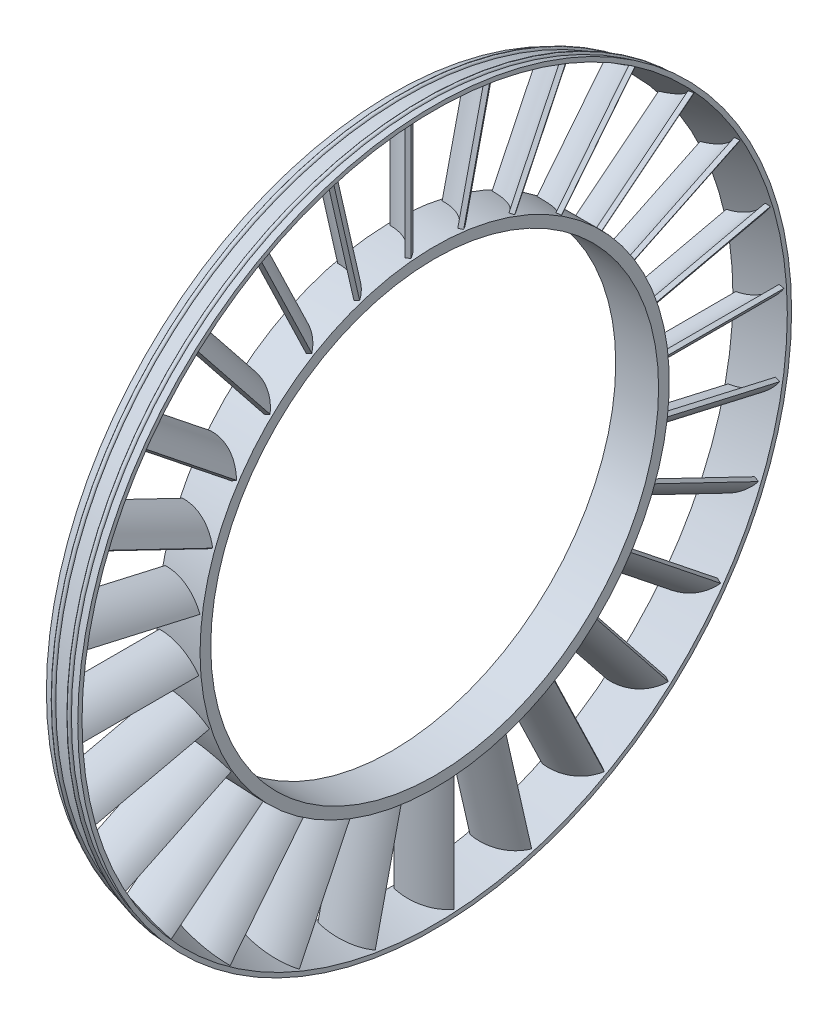
from build123d import *

# Parameters (mm, degrees)
SKETCH1_W           = 20
SKETCH1_H           = 5
EXTRUDE_THIN1_REACH = 237.778
CIRPATTERN1_COUNT   = 28
SKETCH4_R           = 104.5
CUT_EXTRUDE1_DEPTH  = 20


with BuildPart() as part:
    # Sketch1 → Revolve1 (revolve)
    with BuildSketch(Plane.XY):
        with Locations((0, 107)):
            Rectangle(SKETCH1_W, SKETCH1_H)
        with BuildLine():
            Line((-10, 159.2), (10, 164.57))
            Line((10, 164.57), (10, 166.57))
            Line((10, 166.57), (5.965792707, 165.486815342))
            ThreePointArc((5.965792707, 165.486815342), (4.740684658, 166.193292707), (4.034207293, 164.968184658))
            Line((4.034207293, 164.968184658), (-4.034207293, 162.801815342))
            ThreePointArc((-4.034207293, 162.801815342), (-5.259315342, 163.508292707), (-5.965792707, 162.283184658))
            Line((-5.965792707, 162.283184658), (-10, 161.2))
            Line((-10, 161.2), (-10, 159.2))
        make_face()
    revolve(axis=Axis((-19.030612245, 0, 0), (1, 0, 0)))

    # Extrude-Thin1: up to this cone (the profile starts inside it)
    extrude_thin1_end = Plane(origin=(0.462421, 0, 0), z_dir=(1, 0, 0)) * Cone(54.532057568, 269.486262509, 800.574320077, mode=Mode.PRIVATE)
    # Sketch3 → Extrude-Thin1 (add, up to the surface)
    with BuildSketch(Plane(origin=(0, 0, 0), x_dir=(1, 0, 0), z_dir=(0, 1, 0)), mode=Mode.PRIVATE) as extrude_thin1_sk1:
        with BuildLine():
            ThreePointArc((-9, 0), (1.381923414, -2.512537855), (9, -10))
            Line((9, -10), (7.268742617, -11.001372995))
            ThreePointArc((7.268742617, -11.001372995), (0.410637552, -4.260852407), (-8.935595812, -1.998962756))
            Line((-8.935595812, -1.998962756), (-9, 0))
        make_face()
    extrude_thin1_tool1 = extrude(extrude_thin1_sk1.sketch, amount=EXTRUDE_THIN1_REACH, mode=Mode.PRIVATE) & extrude_thin1_end
    extrude_thin1 = extrude_thin1_tool1.solids().sort_by_distance((0.462421, 0, 4.167643))[0]
    add(extrude_thin1)

    # CirPattern1: Extrude-Thin1 ×28 about axis
    cirpattern1_axis = Axis((-19.030612245, 0, 0), (-1, 0, 0))
    for i in range(1, CIRPATTERN1_COUNT):
        add(extrude_thin1.rotate(cirpattern1_axis, i * 360 / CIRPATTERN1_COUNT))

    # Sketch4 → Cut-Extrude1 (cut, symmetric)
    with BuildSketch(Plane(origin=(0, 0, 0), x_dir=(0, 0, -1), z_dir=(1, 0, 0))):
        Circle(SKETCH4_R)
    extrude(amount=CUT_EXTRUDE1_DEPTH, both=True, mode=Mode.SUBTRACT)


solid = part.part
